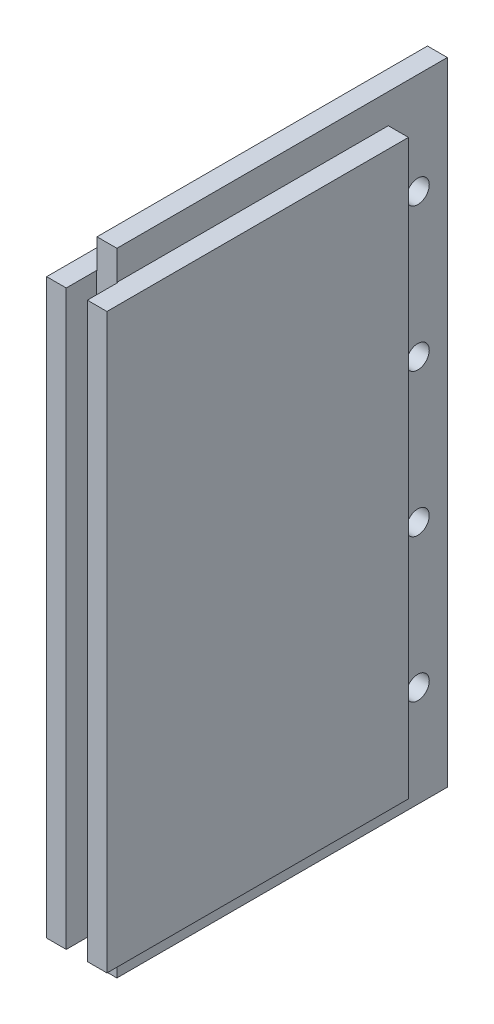
from build123d import *
from OCP.BRepFilletAPI import BRepFilletAPI_MakeChamfer

# Parameters (mm, degrees)
SKETCH2_W           = 95
SKETCH2_H           = 50
BOSS_EXTRUDE1_DEPTH = 10
SKETCH3_W           = 3.3
SKETCH3_H           = 9.8
BOSS_EXTRUDE2_DEPTH = 95
SKETCH4_W           = 3.3
SKETCH4_H           = 59.8
BOSS_EXTRUDE3_DEPTH = 4.9
CUT_EXTRUDE1_REACH  = 113.912
SKETCH5_R           = 1.9
LPATTERN1_COUNT     = 4
LPATTERN1_PITCH     = 23.75
SKETCH7_W           = 3.5
SKETCH7_H           = 104.8
CUT_EXTRUDE6_DEPTH  = 5
SKETCH8_W           = 85
SKETCH8_H           = 35
CUT_EXTRUDE7_DEPTH  = 5
CHAMFER1_SIZE       = 2.5
CHAMFER1_SIZE_2     = 5


with BuildPart() as part:
    # Sketch2 → Boss-Extrude1 (new body)
    with BuildSketch(Plane.YZ):
        with Locations((47.5, 25)):
            Rectangle(SKETCH2_W, SKETCH2_H)
    extrude(amount=-BOSS_EXTRUDE1_DEPTH)

    # Sketch3 → Boss-Extrude2 (add)
    with BuildSketch(Plane(origin=(0, 95, 0), x_dir=(-1, 0, 0), z_dir=(0, 1, 0))):
        with Locations((5, -4.9)):
            Rectangle(SKETCH3_W, SKETCH3_H)
    extrude(amount=-BOSS_EXTRUDE2_DEPTH)

    # Sketch4 → Boss-Extrude3 (add)
    with BuildSketch(Plane(origin=(0, 95, 0), x_dir=(-1, 0, 0), z_dir=(0, 1, 0))):
        with Locations((5, 20.1)):
            Rectangle(SKETCH4_W, SKETCH4_H)
    boss_extrude3 = extrude(amount=BOSS_EXTRUDE3_DEPTH)

    # Mirror1: Boss-Extrude3 across plane
    add(boss_extrude3.mirror(Plane.ZX.offset(47.5)))

    # Sketch5 → Cut-Extrude1 (cut, up to next)
    with BuildSketch(Plane.YZ.offset(-3.35), mode=Mode.PRIVATE) as cut_extrude1_sk1:
        with Locations(Location((11.875, -4.9, 0), (0, 0, 270))):
            Circle(SKETCH5_R)
    cut_extrude1_tool1 = extrude(cut_extrude1_sk1.sketch, amount=-CUT_EXTRUDE1_REACH, mode=Mode.PRIVATE) & part.part
    cut_extrude1 = cut_extrude1_tool1.solids().sort_by_distance((-3.35, 11.875, -4.9))[0]
    add(cut_extrude1, mode=Mode.SUBTRACT)

    # LPattern1: Cut-Extrude1 ×4
    with Locations(*[(0, i * LPATTERN1_PITCH, 0) for i in range(1, LPATTERN1_COUNT)]):
        add(cut_extrude1, mode=Mode.SUBTRACT)

    # Sketch7 → Cut-Extrude6 (cut)
    with BuildSketch(Plane.XY.offset(50)):
        with Locations((-5, 47.5)):
            Rectangle(SKETCH7_W, SKETCH7_H)
    extrude(amount=-CUT_EXTRUDE6_DEPTH, mode=Mode.SUBTRACT)

    # Sketch8 → Cut-Extrude7 (cut)
    with BuildSketch(Plane(origin=(-10, 0, 0), x_dir=(0, -1, 0), z_dir=(-1, 0, 0))):
        with Locations((-47.5, 22.5)):
            Rectangle(SKETCH8_W, SKETCH8_H)
    extrude(amount=-CUT_EXTRUDE7_DEPTH, mode=Mode.SUBTRACT)

    # Chamfer1
    chamfer1_edges_1 = [part.edges().sort_by_distance(p)[0] for p in [
        (-10, 5, 22.5),
    ]]
    chamfer1_side_1 = [part.faces().sort_by_distance(p)[0] for p in [
        (-10, 4.95, 22.5),
    ]]
    chamfer1_edges_2 = [part.edges().sort_by_distance(p)[0] for p in [
        (-10, 47.5, 5),
    ]]
    chamfer1_side_2 = [part.faces().sort_by_distance(p)[0] for p in [
        (-10, 47.5, 4.95),
    ]]
    chamfer1_edges_3 = [part.edges().sort_by_distance(p)[0] for p in [
        (-10, 90, 22.5),
    ]]
    chamfer1_side_3 = [part.faces().sort_by_distance(p)[0] for p in [
        (-10, 90.05, 22.5),
    ]]
    chamfer1_edges_4 = [part.edges().sort_by_distance(p)[0] for p in [
        (-10, 47.5, 40),
    ]]
    chamfer1_side_4 = [part.faces().sort_by_distance(p)[0] for p in [
        (-10, 47.5, 40.05),
    ]]
    chamfer1 = BRepFilletAPI_MakeChamfer(part.part.solid().wrapped)
    for e in chamfer1_edges_1:
        chamfer1.Add(CHAMFER1_SIZE - 0.0001, CHAMFER1_SIZE_2 - 0.0001, e.wrapped, chamfer1_side_1[0].wrapped)
    for e in chamfer1_edges_2:
        chamfer1.Add(CHAMFER1_SIZE - 0.0001, CHAMFER1_SIZE_2 - 0.0001, e.wrapped, chamfer1_side_2[0].wrapped)
    for e in chamfer1_edges_3:
        chamfer1.Add(CHAMFER1_SIZE - 0.0001, CHAMFER1_SIZE_2 - 0.0001, e.wrapped, chamfer1_side_3[0].wrapped)
    for e in chamfer1_edges_4:
        chamfer1.Add(CHAMFER1_SIZE - 0.0001, CHAMFER1_SIZE_2 - 0.0001, e.wrapped, chamfer1_side_4[0].wrapped)
    add(Compound.cast(chamfer1.Shape()), mode=Mode.REPLACE)  # a hair under: the kernel refuses the full size


solid = part.part
